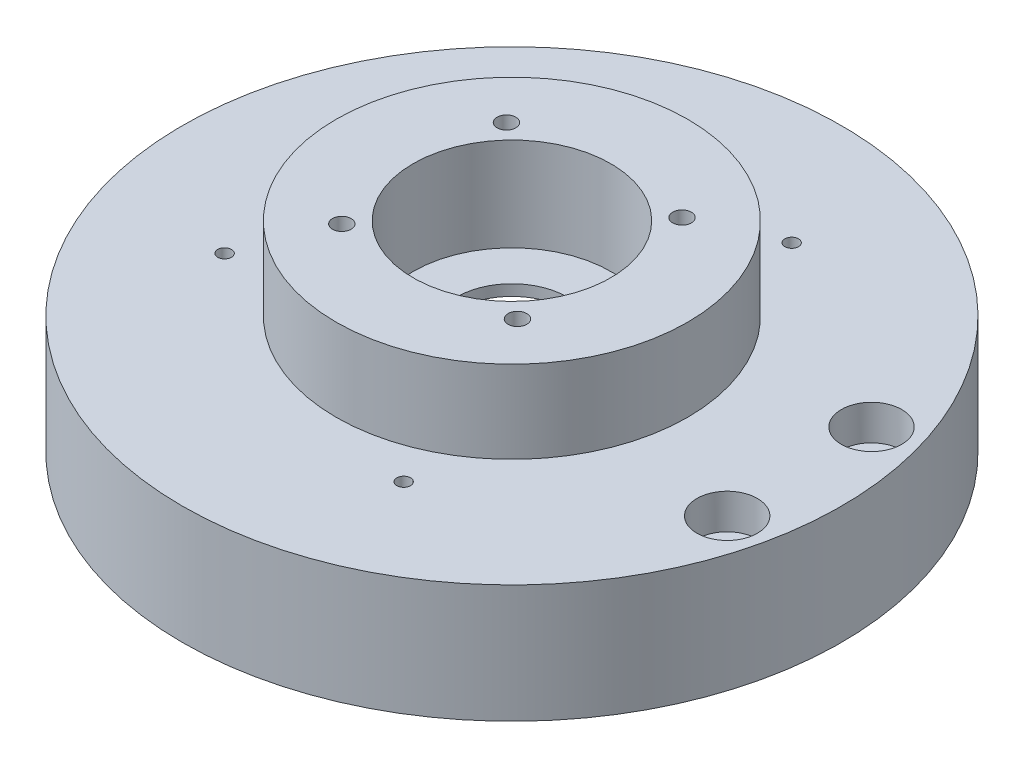
from build123d import *

# Parameters (mm, degrees)
SKETCH1_R                                           = 60
BOSS_EXTRUDE1_DEPTH                                 = 36.5
SKETCH2_R                                           = 55
SKETCH2_R_2                                         = 50
CUT_EXTRUDE1_DEPTH                                  = 5
SKETCH5_W                                           = 18
SKETCH5_H                                           = 17
CBORE_FOR_M6_HEX_SOCKET_HEAD_CAP_SCREW1_D           = 6.4
CBORE_FOR_M6_HEX_SOCKET_HEAD_CAP_SCREW1_CBORE_D     = 11
CBORE_FOR_M6_HEX_SOCKET_HEAD_CAP_SCREW1_CBORE_DEPTH = 21.4
M3_CLEARANCE_HOLE1_D                                = 3.4
CBORE_FOR_M3_HEX_SOCKET_HEAD_CAP_SCREW1_D           = 3.4
CBORE_FOR_M3_HEX_SOCKET_HEAD_CAP_SCREW1_CBORE_D     = 6.5
CBORE_FOR_M3_HEX_SOCKET_HEAD_CAP_SCREW1_CBORE_DEPTH = 5.4
SKETCH12_W                                          = 28
SKETCH12_H                                          = 15
M3_TAPPED_HOLE1_D                                   = 2.5
M3_TAPPED_HOLE1_DEPTH                               = 7.5
M3_TAPPED_HOLE1_TIP                                 = 0.751075774


with BuildPart() as part:
    # Sketch1 → Boss-Extrude1 (new body)
    with BuildSketch(Plane(origin=(0, 0, 0), x_dir=(1, 0, 0), z_dir=(0, 1, 0))):
        Circle(SKETCH1_R)
    extrude(amount=BOSS_EXTRUDE1_DEPTH)

    # Sketch2 → Cut-Extrude1 (cut)
    with BuildSketch(Plane(origin=(0, 0, 0), x_dir=(-1, 0, 0), z_dir=(0, -1, 0))):
        Circle(SKETCH2_R)
        Circle(SKETCH2_R_2, mode=Mode.SUBTRACT)
    extrude(amount=-CUT_EXTRUDE1_DEPTH, mode=Mode.SUBTRACT)

    # Sketch4 → Cut-Revolve1 (revolve, cut)
    with BuildSketch(Plane.XY):
        Polygon((42, 0), (42, 9), (32.5, 9), (32.5, 16.5), (29, 16.5), (29, 17.5), (10, 17.5), (10, 30.321453401), (0, 30.321453401), (0, 0), align=None)
    revolve(axis=Axis((0, 0, 0), (0, 1, 0)), mode=Mode.SUBTRACT)

    # Sketch5 → Cut-Revolve2 (revolve, cut)
    with BuildSketch(Plane.XY):
        with Locations((9, 28)):
            Rectangle(SKETCH5_W, SKETCH5_H)
    revolve(axis=Axis((0, 36.5, 0), (0, -1, 0)), mode=Mode.SUBTRACT)

    # CBORE for M6 Hex Socket Head Cap Screw1 (through all)
    with Locations(Plane(origin=(0, 36.5, 0), x_dir=(1, 0, 0), z_dir=(0, 1, 0))):
        with Locations((51.124173651, -11.94022062), (50.24494344, 15.221552442)):
            CounterBoreHole(CBORE_FOR_M6_HEX_SOCKET_HEAD_CAP_SCREW1_D / 2, CBORE_FOR_M6_HEX_SOCKET_HEAD_CAP_SCREW1_CBORE_D / 2, CBORE_FOR_M6_HEX_SOCKET_HEAD_CAP_SCREW1_CBORE_DEPTH)

    # M3 Clearance Hole1 (through all)
    with Locations(Plane(origin=(0, 36.5, 0), x_dir=(1, 0, 0), z_dir=(0, 1, 0))):
        with Locations((14.984608584, 15.987169155), (15.987169155, -14.984608584), (-14.984608584, -15.987169155), (-15.987169155, 14.984608584)):
            Hole(M3_CLEARANCE_HOLE1_D / 2)

    # CBORE for M3 Hex Socket Head Cap Screw1 (through all)
    with Locations(Plane(origin=(0, 17.5, 0), x_dir=(-1, 0, 0), z_dir=(0, -1, 0))):
        with Locations((15.987169155, 14.984608584), (-14.984608584, 15.987169155), (-15.987169155, -14.984608584), (14.984608584, -15.987169155)):
            CounterBoreHole(CBORE_FOR_M3_HEX_SOCKET_HEAD_CAP_SCREW1_D / 2, CBORE_FOR_M3_HEX_SOCKET_HEAD_CAP_SCREW1_CBORE_D / 2, CBORE_FOR_M3_HEX_SOCKET_HEAD_CAP_SCREW1_CBORE_DEPTH)

    # Sketch12 → Cut-Revolve3 (revolve, cut)
    with BuildSketch(Plane.XY):
        with Locations((-46, 29)):
            Rectangle(SKETCH12_W, SKETCH12_H)
    revolve(axis=Axis((0, 36.5, 0), (0, -1, 0)), mode=Mode.SUBTRACT)

    # M3 Tapped Hole1
    with Locations(Plane(origin=(0, 21.5, 0), x_dir=(1, 0, 0), z_dir=(0, 1, 0))):
        with Locations((13.936224468, 36.986582332), (-36.986582332, 13.936224468), (-36.007862005, -16.299064354), (16.299064354, -36.007862005)):
            Hole(M3_TAPPED_HOLE1_D / 2, depth=M3_TAPPED_HOLE1_DEPTH)
            with Locations((0, 0, -(M3_TAPPED_HOLE1_DEPTH + M3_TAPPED_HOLE1_TIP / 2))):  # 118° drill point
                Cone(0, M3_TAPPED_HOLE1_D / 2, M3_TAPPED_HOLE1_TIP, mode=Mode.SUBTRACT)


solid = part.part
